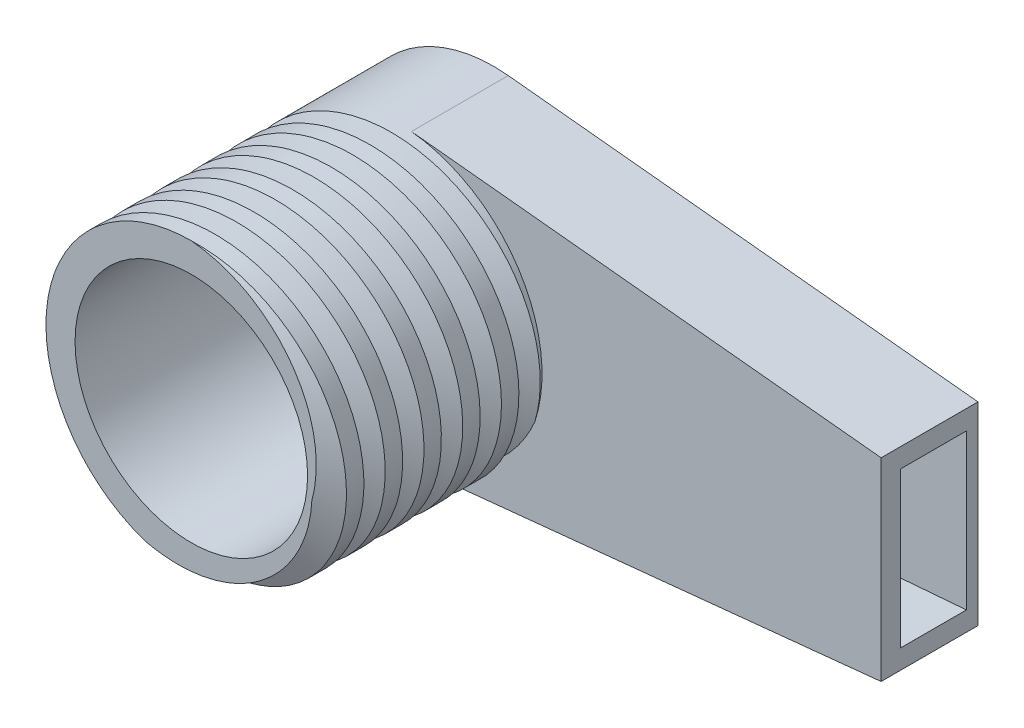
from build123d import *
from build123d.topology import SkipClean

# Parameters (mm, degrees)
SKETCH_1_R           = 7.5
SKETCH_1_R_2         = 6
EXTRUDE_1_DEPTH      = 15
EXTRUDE_START        = 0.6
SKETCH_2_R           = 7.5
EXTRUDE_2_DEPTH      = 0.6
EXTRUDE_5_DEPTH      = 4.4
EXTRUDE_5_DEPTH_BACK = 0.6
LOFT_1_DEPTH         = 3.4
SWEEP_1_PITCH        = 2
SWEEP_1_TO           = 10.6


with BuildPart() as part:
    # 草图1 → 凸台-拉伸1 (new body)
    with BuildSketch(Plane.XY):
        Circle(SKETCH_1_R)
        Circle(SKETCH_1_R_2, mode=Mode.SUBTRACT)
    extrude(amount=EXTRUDE_1_DEPTH)

    # 草图2 → 凸台-拉伸2 (add)
    with BuildSketch(Plane(origin=(0, 0, 0), x_dir=(-1, 0, 0), z_dir=(0, 0, -1)).offset(EXTRUDE_START)):
        Circle(SKETCH_2_R)
    extrude(amount=-EXTRUDE_2_DEPTH)

    # 草图5 → 凸台-拉伸5 (add, two sides: drawn at the far end of the back side and taken through both)
    with SkipClean():  # the faces are left unmerged after this step: merging them gives an invalid solid
        with BuildSketch(Plane.XY.offset(-EXTRUDE_5_DEPTH_BACK)):
            with BuildLine():
                Line((25, 5), (25, -5))
                Line((25, -5), (0.757673893, -7.461630537))
                ThreePointArc((0.757673893, -7.461630537), (7.5, 0), (0.757673893, 7.461630537))
                Line((0.757673893, 7.461630537), (25, 5))
            make_face()
        extrude(amount=EXTRUDE_5_DEPTH + EXTRUDE_5_DEPTH_BACK)

    # 切除-放样1: read off the stored shape, not the designer's step
    # 切除-放样1 outline → 切除-放样1 (cut)
    with SkipClean():  # the faces are left unmerged after this step: merging them gives an invalid solid
        with BuildSketch(Plane.XY):
            with BuildLine():
                Line((25, -4), (25, 4))
                Line((25, 4), (0.953895072, 5.923688394))
                ThreePointArc((0.953895072, 5.923688394), (6, 0), (0.953895072, -5.923688394))
                Line((0.953895072, -5.923688394), (25, -4))
            make_face()
        extrude(amount=LOFT_1_DEPTH, mode=Mode.SUBTRACT)

    # 切除-扫描1: arcs per turn and ends read off the stored shape
    # 切除-扫描1: the profile of 草图9 screwed along a right-hand helix through 7 turns, 10 arcs to a turn; built about Z, then put on its axis
    with SkipClean():  # the faces are left unmerged after this step: merging them gives an invalid solid
        sweep_1_z = Axis((0, 0, 0), (0, 0, 1))
        sweep_1_corners = [(7.5, 0, -2), (7.5, 0.04664346, -3.09901064), (6.3, 0.02332173, -2.54950532)]
        with BuildLine(mode=Mode.PRIVATE) as sweep_1_profile:
            Line(sweep_1_corners[0], sweep_1_corners[1])
            Line(sweep_1_corners[1], sweep_1_corners[2])
            Line(sweep_1_corners[2], sweep_1_corners[0])
        sweep_1_cap = Face(sweep_1_profile.wire())
        sweep_1_turn_angles = [0, 18, 36, 54, 72, 90, 108, 126, 144, 162, 180, 198, 216, 234, 252, 270, 288, 306, 324, 342, 360]
        sweep_1_turn_weights = [1, 0.9510565162951535, 1, 0.9510565162951535, 1, 0.9510565162951535, 1, 0.9510565162951535, 1, 0.9510565162951535, 1, 0.9510565162951535, 1, 0.9510565162951535, 1, 0.9510565162951535, 1, 0.9510565162951535, 1, 0.9510565162951535, 1]
        sweep_1_turn_rails = [Edge.make_bspline([Vector(p[0], p[1], 0).rotate(sweep_1_z, sweep_1_turn_angles[k]) / sweep_1_turn_weights[k] + Vector(0, 0, p[2] + SWEEP_1_PITCH * sweep_1_turn_angles[k] / 360) for k in range(21)], [0, 0, 0, 1, 1, 2, 2, 3, 3, 4, 4, 5, 5, 6, 6, 7, 7, 8, 8, 9, 9, 10, 10, 10], 2, sweep_1_turn_weights) for p in sweep_1_corners]
        sweep_1_turn_sides = [Face.make_surface_from_curves(sweep_1_turn_rails[p[0]], sweep_1_turn_rails[p[1]]) for p in [(0, 1), (1, 2), (2, 0)]]
        sweep_1 = Plane(origin=(0, 0, 15), x_dir=(0, 1, 0), z_dir=(0, 0, -1)) * split(Solid(Shell([*[p.moved(Location((0, 0, SWEEP_1_PITCH * i))) for i in range(7) for p in sweep_1_turn_sides], sweep_1_cap, sweep_1_cap.rotate(sweep_1_z, 2520).moved(Location((0, 0, SWEEP_1_PITCH * 2520 / 360)))])), bisect_by=Plane.XY.offset(SWEEP_1_TO), keep=Keep.BOTTOM, mode=Mode.PRIVATE)
        add(sweep_1, mode=Mode.SUBTRACT)


solid = part.part
